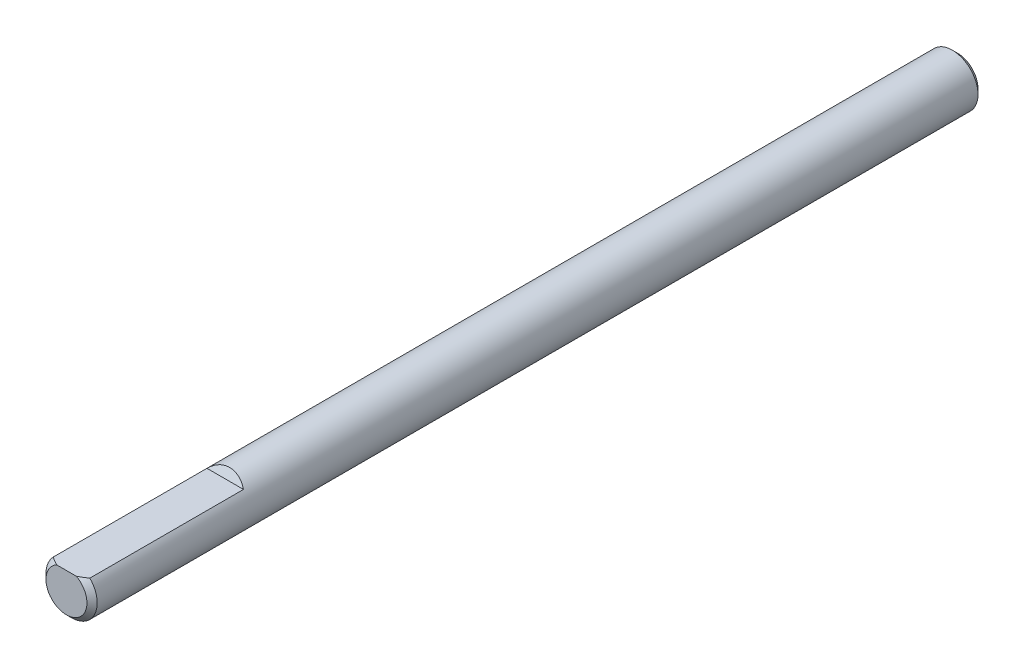
from build123d import *

# Parameters (mm, degrees)
SKETCH1_R           = 2.5
BOSS_EXTRUDE1_DEPTH = 87
SKETCH2_W           = 5
SKETCH2_H           = 0.75
CUT_EXTRUDE1_DEPTH  = 16
CHAMFER1_SIZE       = 0.5
CHAMFER2_SIZE       = 0.866025404
CHAMFER2_SIZE_2     = 0.5


with BuildPart() as part:
    # Sketch1 → Boss-Extrude1 (new body)
    with BuildSketch(Plane.XY):
        Circle(SKETCH1_R)
    extrude(amount=BOSS_EXTRUDE1_DEPTH)

    # Sketch2 → Cut-Extrude1 (cut)
    with BuildSketch(Plane.XY.offset(87)):
        with Locations((0, 2.125)):
            Rectangle(SKETCH2_W, SKETCH2_H)
    extrude(amount=-CUT_EXTRUDE1_DEPTH, mode=Mode.SUBTRACT)

    # Chamfer1
    chamfer1_edges = [part.edges().sort_by_distance(p)[0] for p in [
        (-2.5, 0, 0),
        (-0.945147404, -2.314453798, 87),
    ]]
    chamfer(chamfer1_edges, length=CHAMFER1_SIZE)

    # Chamfer2
    # the kernel refuses this chamfer: 0.866025404, 0.5 mm, written as the material it adds along each edge
    with BuildSketch(Plane(origin=(4.025839092, 1.75, 71), x_dir=(0, 0.999813220622208, -0.01932676561269574), z_dir=(-1, 0, 0))) as chamfer2_piece_1_section:
        Polygon((CHAMFER2_SIZE * 0.999813220373, -CHAMFER2_SIZE * 0.0193267656079), (-CHAMFER2_SIZE_2 * 0.0193267656127, -CHAMFER2_SIZE_2 * 0.999813220622), (0, 0), align=None)
    chamfer2_piece_1 = extrude(amount=8.051678185, mode=Mode.PRIVATE)
    chamfer2_piece_1 = chamfer2_piece_1 & Plane(origin=(0, 0, 71.180869941), x_dir=(1, 0, 0), z_dir=(0, 0, -1)) * Cylinder(2.5, 20, mode=Mode.PRIVATE)
    add(chamfer2_piece_1)


solid = part.part
